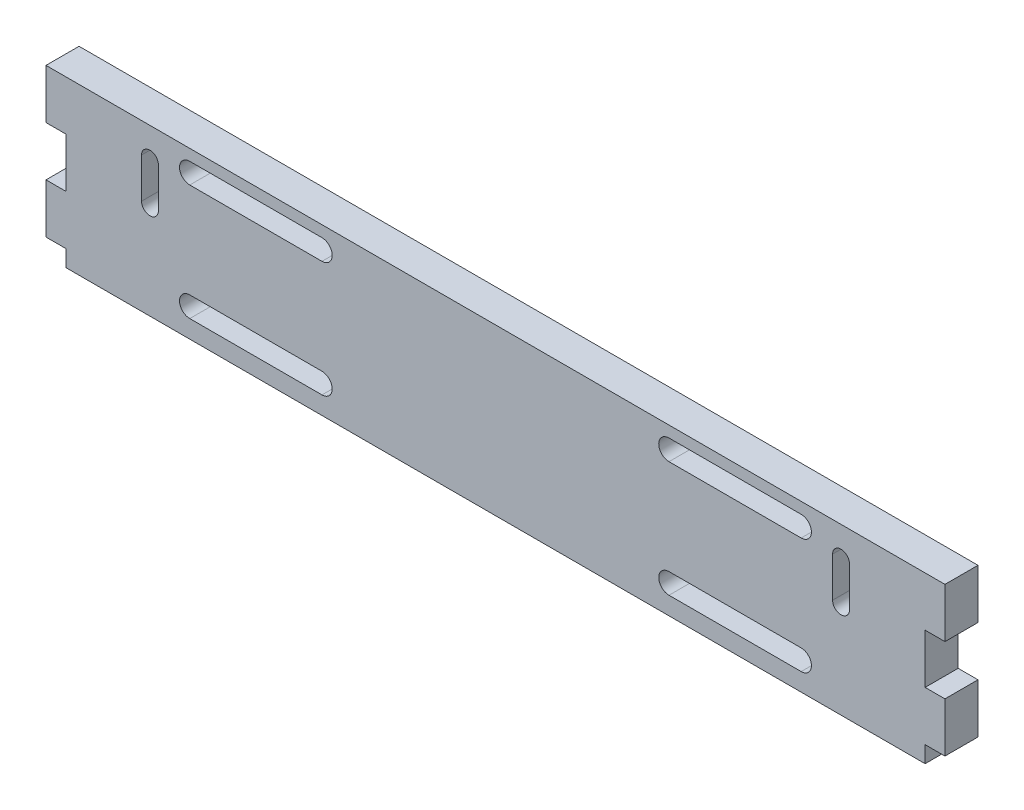
from build123d import *

# Parameters (mm, degrees)
EXTRUDE_1_DEPTH     = 10
CUT_EXTRUDE_1_DEPTH = 140.112364655
CUT_EXTRUDE_2_DEPTH = 140.112364655


with BuildPart() as part:
    # 草圖1 → 填料-伸長1 (new body)
    with BuildSketch(Plane.XY):
        Polygon((136, -22.5), (136, -7.5), (130, -7.5), (130, 7.5), (136, 7.5), (136, 22.5), (-136, 22.5), (-136, 7.5), (-130, 7.5), (-130, -7.5), (-136, -7.5), (-136, -22.5), (-130, -22.5), (-130, -27.5), (130, -27.5), (130, -22.5), align=None)
    extrude(amount=EXTRUDE_1_DEPTH)

    # 草圖2 → 除料-伸長1 (cut, through all)
    with BuildSketch(Plane.XY.offset(10)):
        with BuildLine():
            Line((-92.5, 19.1), (-52.5, 19.1))
            ThreePointArc((-52.5, 19.1), (-49.4, 16), (-52.5, 12.9))
            Line((-52.5, 12.9), (-92.5, 12.9))
            ThreePointArc((-92.5, 12.9), (-95.6, 16), (-92.5, 19.1))
        make_face()
        with BuildLine():
            Line((-92.5, -15.9), (-52.5, -15.9))
            ThreePointArc((-52.5, -15.9), (-49.4, -19), (-52.5, -22.1))
            Line((-52.5, -22.1), (-92.5, -22.1))
            ThreePointArc((-92.5, -22.1), (-95.6, -19), (-92.5, -15.9))
        make_face()
        with BuildLine():
            Line((52.5, 19.1), (92.5, 19.1))
            ThreePointArc((92.5, 19.1), (95.6, 16), (92.5, 12.9))
            Line((92.5, 12.9), (52.5, 12.9))
            ThreePointArc((52.5, 12.9), (49.4, 16), (52.5, 19.1))
        make_face()
        with BuildLine():
            Line((52.5, -15.9), (92.5, -15.9))
            ThreePointArc((92.5, -15.9), (95.6, -19), (92.5, -22.1))
            Line((92.5, -22.1), (52.5, -22.1))
            ThreePointArc((52.5, -22.1), (49.4, -19), (52.5, -15.9))
        make_face()
    extrude(amount=-CUT_EXTRUDE_1_DEPTH, mode=Mode.SUBTRACT)

    # 草圖5 → 除料-伸長2 (cut, through all)
    with BuildSketch(Plane.XY.offset(10)):
        with BuildLine():
            Line((-107.1, 13.45), (-107.1, 1.35))
            ThreePointArc((-107.1, 1.35), (-104.55, -1.2), (-102, 1.35))
            Line((-102, 1.35), (-102, 13.45))
            ThreePointArc((-102, 13.45), (-104.55, 16), (-107.1, 13.45))
        make_face()
        with BuildLine():
            Line((107.1, 13.45), (107.1, 1.35))
            ThreePointArc((107.1, 1.35), (104.55, -1.2), (102, 1.35))
            Line((102, 1.35), (102, 13.45))
            ThreePointArc((102, 13.45), (104.55, 16), (107.1, 13.45))
        make_face()
    extrude(amount=-CUT_EXTRUDE_2_DEPTH, mode=Mode.SUBTRACT)


solid = part.part
